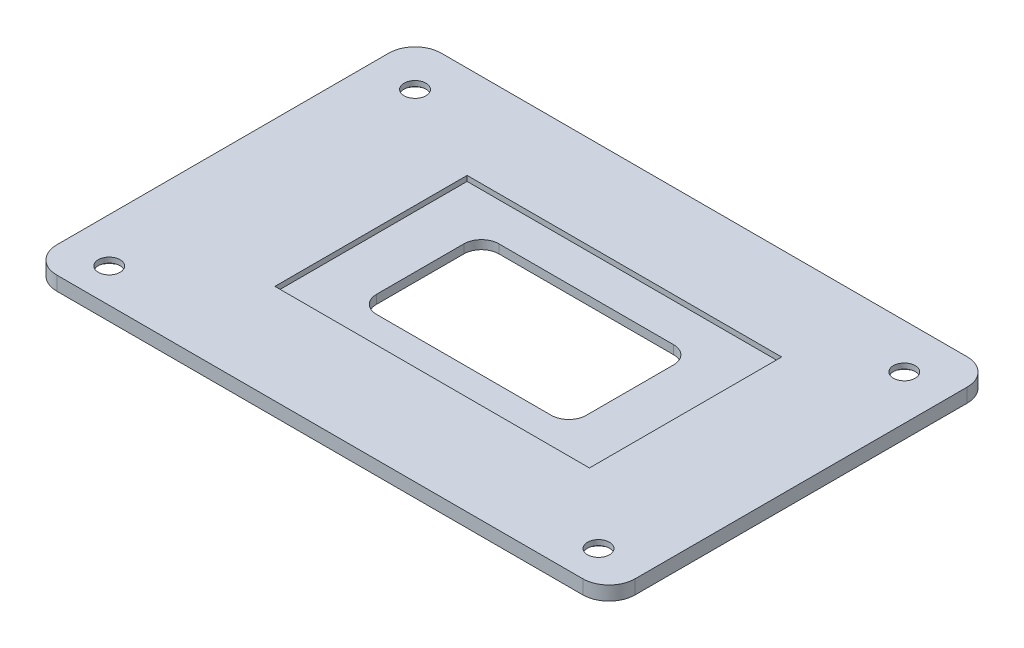
from build123d import *

# Parameters (mm, degrees)
EXTRUDE_1_DEPTH        = 1.6
CUT_EXTRUDE_824_REACH  = 41.777
SKETCH_5_R             = 2.6
CUT_EXTRUDE_1314_DEPTH = 1
CUT_EXTRUDE_1450_REACH = 41.757
SKETCH_7_R             = 1.25
SKETCH_9_W             = 36
SKETCH_9_H             = 22
CUT_EXTRUDE_2010_DEPTH = 0.6


with BuildPart() as part:
    # 草图1 → 凸台-拉伸1 (new body)
    with BuildSketch(Plane(origin=(0, 0, 0), x_dir=(1, 0, 0), z_dir=(0, 1, 0))):
        with BuildLine():
            Line((-30.1, -22), (30.1, -22))
            ThreePointArc((30.1, -22), (32.221320344, -21.121320344), (33.1, -19))
            Line((33.1, -19), (33.1, 19))
            ThreePointArc((33.1, 19), (32.221320344, 21.121320344), (30.1, 22))
            Line((30.1, 22), (-30.1, 22))
            ThreePointArc((-30.1, 22), (-32.221320344, 21.121320344), (-33.1, 19))
            Line((-33.1, 19), (-33.1, -19))
            ThreePointArc((-33.1, -19), (-32.221320344, -21.121320344), (-30.1, -22))
        make_face()
    extrude(amount=EXTRUDE_1_DEPTH)

    # 草图3 → Cut-Extrude 824 (cut, up to next)
    with BuildSketch(Plane(origin=(0, 1.6, 0), x_dir=(1, 0, 0), z_dir=(0, 1, 0)), mode=Mode.PRIVATE) as cut_extrude_824_sk1:
        with BuildLine():
            Line((-8.5, -7), (11.5, -7))
            ThreePointArc((11.5, -7), (12.914213562, -6.414213562), (13.5, -5))
            Line((13.5, -5), (13.5, 5))
            ThreePointArc((13.5, 5), (12.914213562, 6.414213562), (11.5, 7))
            Line((11.5, 7), (-8.5, 7))
            ThreePointArc((-8.5, 7), (-9.914213562, 6.414213562), (-10.5, 5))
            Line((-10.5, 5), (-10.5, -5))
            ThreePointArc((-10.5, -5), (-9.914213562, -6.414213562), (-8.5, -7))
        make_face()
    cut_extrude_824_tool1 = extrude(cut_extrude_824_sk1.sketch, amount=-CUT_EXTRUDE_824_REACH, mode=Mode.PRIVATE) & part.part
    add(cut_extrude_824_tool1.solids().sort_by_distance((1.5, 1.6, 0))[0], mode=Mode.SUBTRACT)

    # 草图5 → Cut-Extrude 1314 (cut)
    with BuildSketch(Plane.XZ):
        with Locations((-28, -16.9)):
            Circle(SKETCH_5_R)
        with Locations((28, -16.9)):
            Circle(SKETCH_5_R)
        with Locations((28, 18.1)):
            Circle(SKETCH_5_R)
        with Locations((-28, 18.1)):
            Circle(SKETCH_5_R)
    extrude(amount=-CUT_EXTRUDE_1314_DEPTH, mode=Mode.SUBTRACT)

    # 草图7 → Cut-Extrude 1450 (cut, up to next)
    with BuildSketch(Plane.XZ.offset(-1), mode=Mode.PRIVATE) as cut_extrude_1450_sk1:
        with Locations((-28, -16.9)):
            Circle(SKETCH_7_R)
    cut_extrude_1450_tool1 = extrude(cut_extrude_1450_sk1.sketch, amount=-CUT_EXTRUDE_1450_REACH, mode=Mode.PRIVATE) & part.part
    # 草图7 → Cut-Extrude 1450 (cut, up to next)
    with BuildSketch(Plane.XZ.offset(-1), mode=Mode.PRIVATE) as cut_extrude_1450_sk2:
        with Locations((28, -16.9)):
            Circle(SKETCH_7_R)
    cut_extrude_1450_tool2 = extrude(cut_extrude_1450_sk2.sketch, amount=-CUT_EXTRUDE_1450_REACH, mode=Mode.PRIVATE) & part.part
    # 草图7 → Cut-Extrude 1450 (cut, up to next)
    with BuildSketch(Plane.XZ.offset(-1), mode=Mode.PRIVATE) as cut_extrude_1450_sk3:
        with Locations((28, 18.1)):
            Circle(SKETCH_7_R)
    cut_extrude_1450_tool3 = extrude(cut_extrude_1450_sk3.sketch, amount=-CUT_EXTRUDE_1450_REACH, mode=Mode.PRIVATE) & part.part
    # 草图7 → Cut-Extrude 1450 (cut, up to next)
    with BuildSketch(Plane.XZ.offset(-1), mode=Mode.PRIVATE) as cut_extrude_1450_sk4:
        with Locations((-28, 18.1)):
            Circle(SKETCH_7_R)
    cut_extrude_1450_tool4 = extrude(cut_extrude_1450_sk4.sketch, amount=-CUT_EXTRUDE_1450_REACH, mode=Mode.PRIVATE) & part.part
    add(cut_extrude_1450_tool1.solids().sort_by_distance((-28, 1, -16.9))[0], mode=Mode.SUBTRACT)
    add(cut_extrude_1450_tool2.solids().sort_by_distance((28, 1, -16.9))[0], mode=Mode.SUBTRACT)
    add(cut_extrude_1450_tool3.solids().sort_by_distance((28, 1, 18.1))[0], mode=Mode.SUBTRACT)
    add(cut_extrude_1450_tool4.solids().sort_by_distance((-28, 1, 18.1))[0], mode=Mode.SUBTRACT)

    # 草图9 → Cut-Extrude 2010 (cut)
    with BuildSketch(Plane(origin=(0, 1.6, 0), x_dir=(1, 0, 0), z_dir=(0, 1, 0))):
        with Locations((1.500900608, 0.362797629)):
            Rectangle(SKETCH_9_W, SKETCH_9_H)
    extrude(amount=-CUT_EXTRUDE_2010_DEPTH, mode=Mode.SUBTRACT)


solid = part.part
